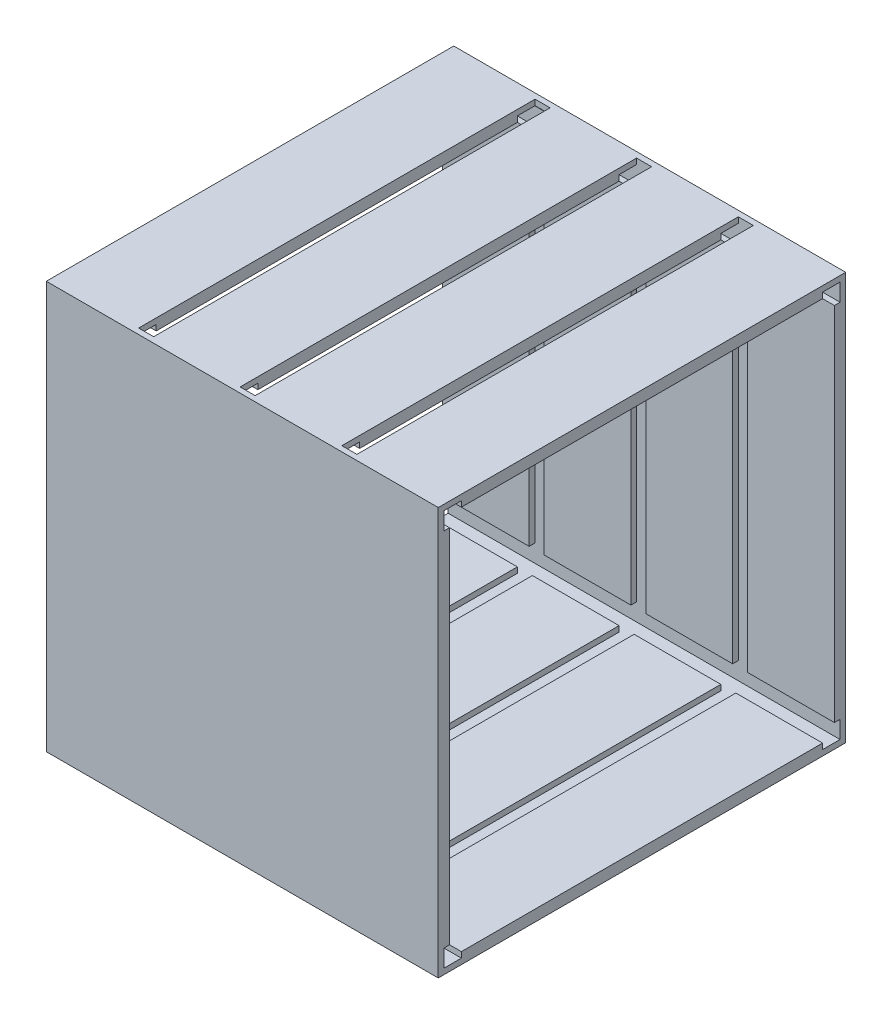
from build123d import *

# Parameters (mm, degrees)
SKETCH1_W            = 688.1
SKETCH1_H            = 688.1
SKETCH1_W_2          = 650
SKETCH1_H_2          = 650
BOSS_EXTRUDE1_DEPTH  = 661.9
SKETCH3_W            = 25.4
SKETCH3_H            = 650
CUT_EXTRUDE1_DEPTH   = 9.525
SKETCH4_W            = 25.4
SKETCH4_H            = 669.5
SKETCH4_H_2          = 669.05
CUT_EXTRUDE3_DEPTH   = 9.525
SKETCH6_W            = 25.4
SKETCH6_H            = 669.5
CUT_EXTRUDE4_DEPTH   = 9.525
CUT_EXTRUDE5_DEPTH   = 700
MIRROR6_COPY_1_DEPTH = 700
MIRROR6_COPY_2_DEPTH = 700


with BuildPart() as part:
    # Sketch1 → Boss-Extrude1 (new body)
    with BuildSketch(Plane(origin=(0, 0, 0), x_dir=(0, 0, -1), z_dir=(1, 0, 0))):
        with Locations((344.05, 344.05)):
            Rectangle(SKETCH1_W, SKETCH1_H)
        with Locations((344.05, 344.05)):
            Rectangle(SKETCH1_W_2, SKETCH1_H_2, mode=Mode.SUBTRACT)
    extrude(amount=BOSS_EXTRUDE1_DEPTH)

    # Sketch3 → Cut-Extrude1 (cut)
    with BuildSketch(Plane.XY.offset(-669.05)):
        with Locations((159.125, 344.05)):
            Rectangle(SKETCH3_W, SKETCH3_H)
        with Locations((330.95, 344.05)):
            Rectangle(SKETCH3_W, SKETCH3_H)
        with Locations((502.775, 344.05)):
            Rectangle(SKETCH3_W, SKETCH3_H)
    cut_extrude1 = extrude(amount=-CUT_EXTRUDE1_DEPTH, mode=Mode.SUBTRACT)

    # Mirror2: Cut-Extrude1 across plane
    add(cut_extrude1.mirror(Plane(origin=(0, 0, -344.05), x_dir=(1, 0, 0), z_dir=(0, 0, -1))), mode=Mode.SUBTRACT)

    # Sketch4 → Cut-Extrude3 (cut)
    with BuildSketch(Plane(origin=(0, 19.05, 0), x_dir=(1, 0, 0), z_dir=(0, 1, 0))):
        with Locations((159.125, 343.825)):
            Rectangle(SKETCH4_W, SKETCH4_H)
        with Locations((330.95, 343.825)):
            Rectangle(SKETCH4_W, SKETCH4_H)
        with Locations((502.775, 344.05)):
            Rectangle(SKETCH4_W, SKETCH4_H_2)
    cut_extrude3 = extrude(amount=-CUT_EXTRUDE3_DEPTH, mode=Mode.SUBTRACT)

    # Mirror4: Cut-Extrude3 across plane
    add(cut_extrude3.mirror(Plane.ZX.offset(344.05)), mode=Mode.SUBTRACT)

    # Sketch6 → Cut-Extrude4 (cut)
    with BuildSketch(Plane(origin=(0, 688.1, 0), x_dir=(1, 0, 0), z_dir=(0, 1, 0))):
        with Locations((159.125, 344.275)):
            Rectangle(SKETCH6_W, SKETCH6_H)
        with Locations((330.95, 343.825)):
            Rectangle(SKETCH6_W, SKETCH6_H)
        with Locations((502.775, 343.825)):
            Rectangle(SKETCH6_W, SKETCH6_H)
    extrude(amount=-CUT_EXTRUDE4_DEPTH, mode=Mode.SUBTRACT)

    # Sketch7 → Cut-Extrude5 (cut)
    with BuildSketch(Plane.ZY):
        Polygon((-19.05, 39.05), (-9.525, 39.05), (-9.525, 9.525), (-39.05, 9.525), (-39.05, 19.05), (-19.05, 19.05), align=None)
    cut_extrude5 = extrude(amount=-CUT_EXTRUDE5_DEPTH, mode=Mode.SUBTRACT)

    # Mirror5: Cut-Extrude5 across plane
    add(cut_extrude5.mirror(Plane(origin=(0, 0, -344.05), x_dir=(1, 0, 0), z_dir=(0, 0, -1))), mode=Mode.SUBTRACT)

    # Mirror6 copy 1 sketch → Mirror6 copy 1 (cut)
    with BuildSketch(Plane(origin=(0, 688.1, -688.1), x_dir=(0, 0, -1), z_dir=(-1, 0, 0))):
        Polygon((-19.05, 39.05), (-9.525, 39.05), (-9.525, 9.525), (-39.05, 9.525), (-39.05, 19.05), (-19.05, 19.05), align=None)
    extrude(amount=-MIRROR6_COPY_1_DEPTH, mode=Mode.SUBTRACT)

    # Mirror6 copy 2 sketch → Mirror6 copy 2 (cut)
    with BuildSketch(Plane(origin=(0, 688.1, 0), x_dir=(0, 0, 1), z_dir=(-1, 0, 0))):
        Polygon((-19.05, -39.05), (-9.525, -39.05), (-9.525, -9.525), (-39.05, -9.525), (-39.05, -19.05), (-19.05, -19.05), align=None)
    extrude(amount=-MIRROR6_COPY_2_DEPTH, mode=Mode.SUBTRACT)


solid = part.part
